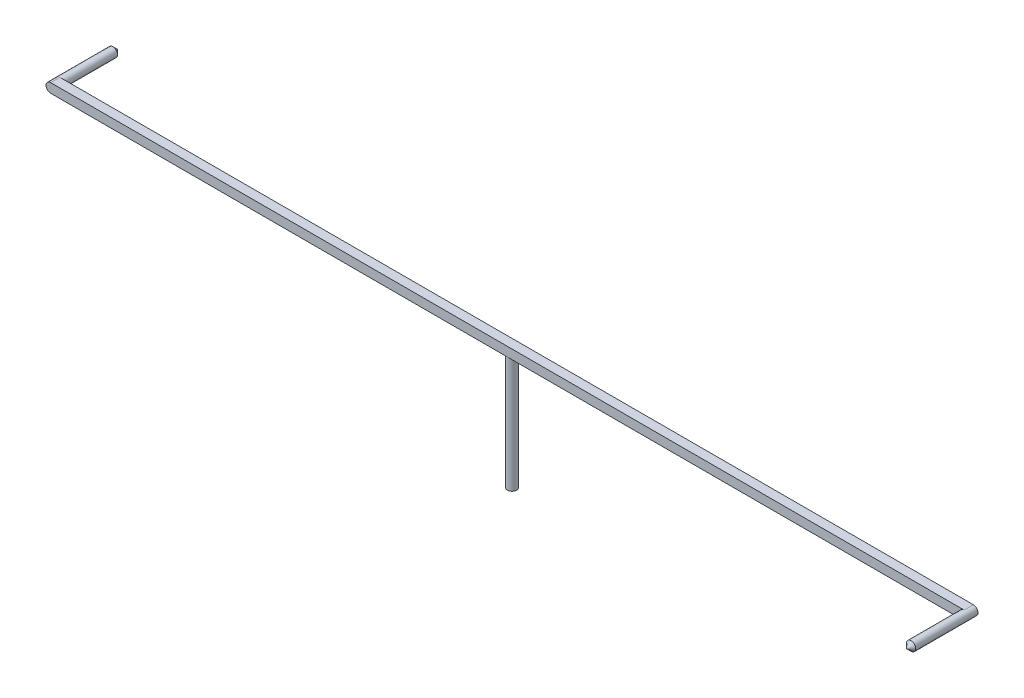
from build123d import *

# Parameters (mm, degrees)
SKETCH_1_R      = 0.4
EXTRUDE_1_DEPTH = 10
SKETCH_2_W      = 80
SKETCH_2_H      = 0.8
EXTRUDE_2_DEPTH = 0.8
FILLET_1_R      = 0.4
SKETCH_3_R      = 0.4
EXTRUDE_3_DEPTH = 5
SKETCH_4_R      = 0.4
EXTRUDE_4_DEPTH = 5
CHAMFER_1_SIZE  = 0.4


with BuildPart() as part:
    # 草图1 → 凸台-拉伸1 (new body)
    with BuildSketch(Plane(origin=(0, 0, 0), x_dir=(1, 0, 0), z_dir=(0, 1, 0))):
        with Locations(Location((0, 0, 0), (0, 0, 270))):
            Circle(SKETCH_1_R)
    extrude(amount=EXTRUDE_1_DEPTH)

    # 草图2 → 凸台-拉伸2 (add)
    with BuildSketch(Plane(origin=(0, 10, 0), x_dir=(1, 0, 0), z_dir=(0, 1, 0))):
        Rectangle(SKETCH_2_W, SKETCH_2_H)
    extrude(amount=EXTRUDE_2_DEPTH)

    # 圆角1
    fillet_1_edges = [part.edges().sort_by_distance(p)[0] for p in [
        (40, 10, 0),
        (40, 10.8, 0),
        (-40, 10, 0),
        (-40, 10.8, 0),
    ]]
    fillet(fillet_1_edges, radius=FILLET_1_R - 0.0001)  # a hair under: the kernel refuses the full size

    # 草图3 → 凸台-拉伸3 (add)
    with BuildSketch(Plane.XY.offset(0.4)):
        with Locations((39.6, 10.4)):
            Circle(SKETCH_3_R)
    extrude(amount=EXTRUDE_3_DEPTH)

    # 草图4 → 凸台-拉伸4 (add)
    with BuildSketch(Plane(origin=(0, 0, -0.4), x_dir=(-1, 0, 0), z_dir=(0, 0, -1))):
        with Locations((39.6, 10.4)):
            Circle(SKETCH_4_R)
    extrude(amount=EXTRUDE_4_DEPTH)

    # 倒角1
    chamfer_1_edges = [part.edges().sort_by_distance(p)[0] for p in [
        (39.2, 10.4, 5.4),
        (-39.2, 10.4, -5.4),
    ]]
    chamfer(chamfer_1_edges, length=CHAMFER_1_SIZE - 0.0001)  # a hair under: the kernel refuses the full size


solid = part.part
